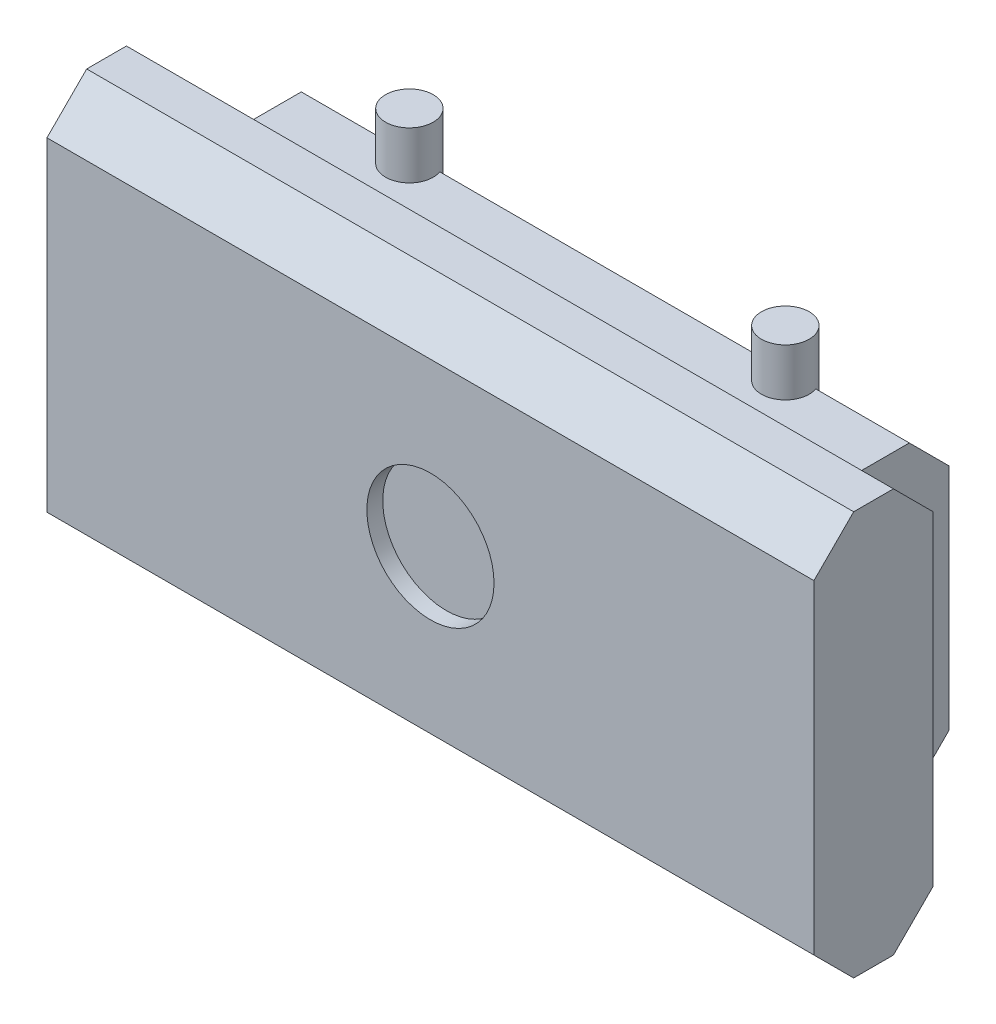
from build123d import *

# Parameters (mm, degrees)
SKETCH1_W            = 965
SKETCH1_H            = 508
BOSS_EXTRUDE1_DEPTH  = 150
SKETCH2_W            = 765
SKETCH2_H            = 388
BOSS_EXTRUDE2_DEPTH  = 120
SKETCH3_R            = 30
BOSS_EXTRUDE3_DEPTH  = 60
LPATTERN2_COUNT      = 2
LPATTERN2_PITCH      = 448
LPATTERN2_COUNT_DIR2 = 2
LPATTERN2_PITCH_DIR2 = 473
CHAMFER1_SIZE        = 50
SKETCH4_R            = 60
SKETCH4_R_2          = 40
BOSS_EXTRUDE4_DEPTH  = 10
SKETCH5_R            = 80
CUT_EXTRUDE1_DEPTH   = 20


with BuildPart() as part:
    # Sketch1 → Boss-Extrude1 (new body)
    with BuildSketch(Plane.XY):
        Rectangle(SKETCH1_W, SKETCH1_H)
    extrude(amount=BOSS_EXTRUDE1_DEPTH)


with BuildPart() as body_2:
    # Sketch2 → Boss-Extrude2 (new body)
    with BuildSketch(Plane.XY):
        Rectangle(SKETCH2_W, SKETCH2_H)
    extrude(amount=-BOSS_EXTRUDE2_DEPTH)


with BuildPart() as body_3:
    # Sketch3 → Boss-Extrude3 (new body)
    with BuildSketch(Plane.XZ.offset(194)):
        with Locations(Location((236.5, -60, 0), (0, 0, 270))):
            Circle(SKETCH3_R)
    boss_extrude3 = extrude(amount=BOSS_EXTRUDE3_DEPTH)


with BuildPart() as lpattern2_1:
    # LPattern2: pattern copy
    add(boss_extrude3.moved(Location(Vector(0, 1, 0) * (0 * LPATTERN2_PITCH) + Vector(-1, 0, 0) * (1 * LPATTERN2_PITCH_DIR2))))


with BuildPart() as lpattern2_2:
    # LPattern2: pattern copy
    add(boss_extrude3.moved(Location(Vector(0, 1, 0) * (1 * LPATTERN2_PITCH) + Vector(-1, 0, 0) * (0 * LPATTERN2_PITCH_DIR2))))


with BuildPart() as lpattern2_3:
    # LPattern2: pattern copy
    add(boss_extrude3.moved(Location(Vector(0, 1, 0) * (1 * LPATTERN2_PITCH) + Vector(-1, 0, 0) * (1 * LPATTERN2_PITCH_DIR2))))


with BuildPart() as part_1:
    add(part.part)

    # Combine1: union body 2
    add(body_2.part)

    # Combine4: union body 3, LPattern2_1
    add(body_3.part)
    add(lpattern2_1.part)


with BuildPart() as lpattern2_2_1:
    add(lpattern2_2.part)

    # Combine5: union LPattern2_3, part
    add(lpattern2_3.part)
    add(part_1.part)

    # Chamfer1
    # the kernel refuses this chamfer: 50 mm, written as the material it takes off along each edge
    with BuildSketch(Plane(origin=(611.084149398, -254, 0), x_dir=(0, -0.027495876610586594, 0.9996219169112966), z_dir=(-1, 0, 0)), Plane(origin=(-611.084149398, 254, 150), x_dir=(0, -0.9996219169112966, 0.027495876610586587), z_dir=(1, 0, 0))) as chamfer1_piece_1:
        Polygon((CHAMFER1_SIZE * 0.999621916911, CHAMFER1_SIZE * 0.0274958766106), (-CHAMFER1_SIZE * 0.0274958766106, CHAMFER1_SIZE * 0.999621916911), (0, 0), align=None)
    extrude(amount=1222.168298797, mode=Mode.SUBTRACT)
    with BuildSketch(Plane(origin=(-611.084149398, 254, 0), x_dir=(0, -0.9996219169112966, -0.02749587661058636), z_dir=(1, 0, 0)), Plane(origin=(611.084149398, -254, 150), x_dir=(0, -0.027495876610586594, -0.9996219169112966), z_dir=(-1, 0, 0))) as chamfer1_piece_2:
        Polygon((CHAMFER1_SIZE * 0.999621916911, -CHAMFER1_SIZE * 0.0274958766106), (-CHAMFER1_SIZE * 0.0274958766106, -CHAMFER1_SIZE * 0.999621916911), (0, 0), align=None)
    extrude(amount=1222.168298797, mode=Mode.SUBTRACT)
    with BuildSketch(Plane(origin=(-511.084149398, 194, -120), x_dir=(0, 0.027495876610586594, 0.9996219169112966), z_dir=(1, 0, 0))) as chamfer1_piece_3_section:
        Polygon((CHAMFER1_SIZE * 0.999621916911, CHAMFER1_SIZE * 0.0274958766106), (-CHAMFER1_SIZE * 0.0274958766106, CHAMFER1_SIZE * 0.999621916911), (0, 0), align=None)
    chamfer1_piece_3 = extrude(amount=1022.168298797, mode=Mode.PRIVATE)
    chamfer1_piece_3 = chamfer1_piece_3 - Plane(origin=(-236.5, 177.365883925, -60), x_dir=(0, 0, -1), z_dir=(0, 1, 0)) * Cylinder(30, 2245, mode=Mode.PRIVATE)
    chamfer1_piece_3 = chamfer1_piece_3 - Plane(origin=(236.5, 177.365883925, -60), x_dir=(0, 0, -1), z_dir=(0, 1, 0)) * Cylinder(30, 2245, mode=Mode.PRIVATE)
    add(chamfer1_piece_3, mode=Mode.SUBTRACT)
    with BuildSketch(Plane(origin=(511.084149398, -194, -120), x_dir=(0, -0.027495876610586594, 0.9996219169112966), z_dir=(-1, 0, 0))) as chamfer1_piece_4_section:
        Polygon((CHAMFER1_SIZE * 0.999621916911, CHAMFER1_SIZE * 0.0274958766106), (-CHAMFER1_SIZE * 0.0274958766106, CHAMFER1_SIZE * 0.999621916911), (0, 0), align=None)
    chamfer1_piece_4 = extrude(amount=1022.168298797, mode=Mode.PRIVATE)
    chamfer1_piece_4 = chamfer1_piece_4 - Plane(origin=(236.5, -177.365883925, -60), x_dir=(0, 0, -1), z_dir=(0, 1, 0)) * Cylinder(30, 2245, mode=Mode.PRIVATE)
    chamfer1_piece_4 = chamfer1_piece_4 - Plane(origin=(-236.5, -177.365883925, -60), x_dir=(0, 0, -1), z_dir=(0, 1, 0)) * Cylinder(30, 2245, mode=Mode.PRIVATE)
    add(chamfer1_piece_4, mode=Mode.SUBTRACT)

    # Sketch4 → Boss-Extrude4 (add)
    # profile 1 of 2: a face of its own
    with BuildSketch(Plane.ZY.offset(482.5)):
        with Locations(Location((75, 114, 0), (0, 0, 180))):
            Circle(SKETCH4_R)
        with Locations((75, 114)):
            Circle(SKETCH4_R_2, mode=Mode.SUBTRACT)
    # profile 2 of 2: a face of its own
    with BuildSketch(Plane.ZY.offset(482.5)):
        with Locations(Location((75, -114, 0), (0, 0, 180))):
            Circle(SKETCH4_R)
        with Locations((75, -114)):
            Circle(SKETCH4_R_2, mode=Mode.SUBTRACT)
    extrude(amount=BOSS_EXTRUDE4_DEPTH)

    # Sketch5 → Cut-Extrude1 (cut)
    with BuildSketch(Plane.XY.offset(150)):
        Circle(SKETCH5_R)
    extrude(amount=-CUT_EXTRUDE1_DEPTH, mode=Mode.SUBTRACT)


solid = lpattern2_2_1.part
